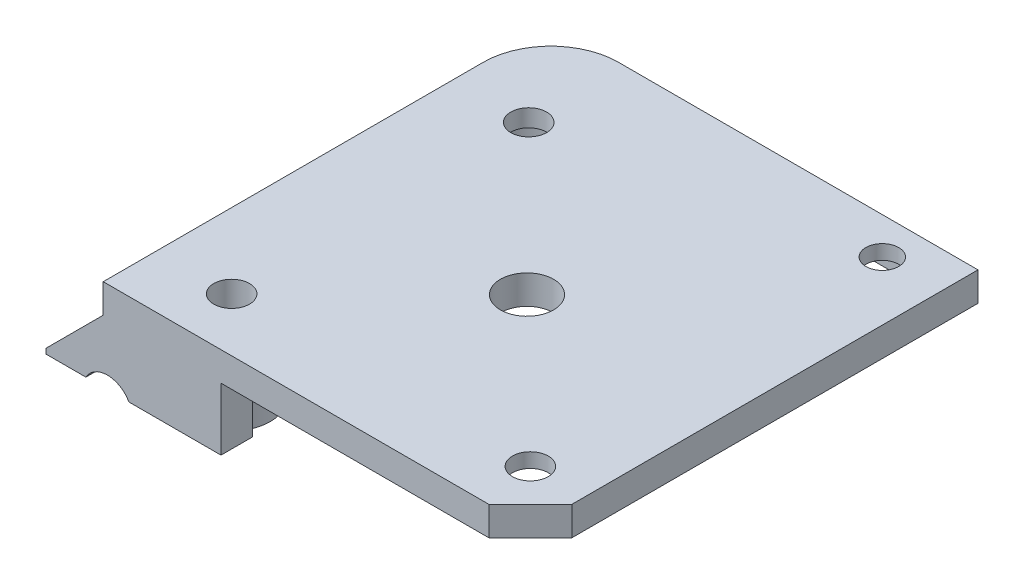
from build123d import *

# Parameters (mm, degrees)
SKETCH1_R                  = 13.5
BOSS_EXTRUDE1_DEPTH        = 3
CAVITY26_OUTLINE_R         = 1.85
CAVITY26_OUTLINE_R_2       = 1.7
CAVITY26_DEPTH             = 1.5
F_24_0_24_DIAMETER_HOLE1_D = 3.7
BOSS_EXTRUDE2_START        = -3
SKETCH6_R                  = 13.5
BOSS_EXTRUDE2_DEPTH        = 3
F_24_0_24_DIAMETER_HOLE2_D = 5.5
SKETCH14_W                 = 5.92
SKETCH14_H                 = 13
BOSS_EXTRUDE6_DEPTH        = 9.45
SKETCH13_R                 = 4
BOSS_EXTRUDE7_DEPTH        = 6.45
BOSS_EXTRUDE8_DEPTH        = 6.45
F_24_0_24_DIAMETER_HOLE3_D = 3.7
CUT_EXTRUDE3_DEPTH         = 9.06
SKETCH19_R                 = 2.55
CUT_EXTRUDE4_DEPTH         = 1.8
CUT_EXTRUDE5_START         = -11.2
SKETCH23_R                 = 4.233528458
CUT_EXTRUDE5_DEPTH         = 2.14
SKETCH24_W                 = 2.756109072
SKETCH24_H                 = 9.9
CUT_EXTRUDE6_DEPTH         = 10
CAVITY27_DEPTH             = 1.5
CAVITY27_START             = -6.45
CAVITY27_2_OUTLINE_R       = 3.15
CAVITY27_2_OUTLINE_R_2     = 1.85
CAVITY27_2_DEPTH           = 1.8
BOSS_EXTRUDE9_START        = 1.8
SKETCH25_R                 = 6.6
SKETCH25_R_2               = 1.85
BOSS_EXTRUDE9_DEPTH        = 1.8
SKETCH26_R                 = 4.5
CUT_EXTRUDE7_DEPTH         = 3
SKETCH27_R                 = 1.85
BOSS_EXTRUDE10_DEPTH       = 3
CUT_EXTRUDE8_START         = -1.5
CUT_EXTRUDE8_DEPTH         = 1.5
CUT_EXTRUDE9_DEPTH         = 15
F_24_0_24_DIAMETER_HOLE4_D = 3.4


# Read off the part's stored shape, not the designer's step: Cavity26, Cavity27
with BuildPart() as part:
    # Sketch1 → Boss-Extrude1 (new body)
    with BuildSketch(Plane(origin=(0, 0, 0), x_dir=(1, 0, 0), z_dir=(0, 1, 0))):
        with BuildLine():
            Line((39.88, -46.3), (44.18, -42))
            Line((44.18, -42), (44.18, 0))
            Line((44.18, 0), (7, 0))
            ThreePointArc((7, 0), (2.050252532, -2.050252532), (0, -7))
            Line((0, -7), (0, -46.3))
            Line((0, -46.3), (39.88, -46.3))
        make_face()
        with Locations(Location((23.07, -25.54, 0), (0, 0, 270))):
            Circle(SKETCH1_R, mode=Mode.SUBTRACT)
    extrude(amount=BOSS_EXTRUDE1_DEPTH)

    # Cavity26 outline → Cavity26 (cut)
    # profile 1 of 2: a face of its own
    with BuildSketch(Plane(origin=(0, 0, 0), x_dir=(1, 0, 0), z_dir=(0, 1, 0))):
        with BuildLine():
            Line((40.98, -20.5), (35.593913126, -20.5))
            ThreePointArc((35.593913126, -20.5), (36.300391291, -22.855461624), (36.567866498, -25.3))
            Line((36.567866498, -25.3), (40.93, -25.3))
            Line((40.93, -25.3), (40.93, -37.4))
            Line((40.93, -37.4), (37.464525778, -37.4))
            ThreePointArc((37.464525778, -37.4), (35.919832787, -38.039832787), (35.28, -39.584525778))
            Line((35.28, -39.584525778), (35.28, -43.05))
            Line((35.28, -43.05), (12.18, -43.05))
            Line((12.18, -43.05), (12.18, -44.675))
            Line((12.18, -44.675), (39.2422583, -44.675))
            Line((39.2422583, -44.675), (42.58, -41.3372583))
            Line((42.58, -41.3372583), (42.58, -22.55))
            Line((42.58, -22.55), (40.98, -22.55))
            Line((40.98, -22.55), (40.98, -20.5))
        make_face()
        with Locations((38.63, -40.75)):
            Circle(CAVITY26_OUTLINE_R, mode=Mode.SUBTRACT)
    # profile 2 of 2: a face of its own
    with BuildSketch(Plane(origin=(0, 0, 0), x_dir=(1, 0, 0), z_dir=(0, 1, 0))):
        with BuildLine():
            Line((40.98, -6.35), (42.58, -6.35))
            Line((42.58, -6.35), (42.58, -1.6))
            Line((42.58, -1.6), (28.18, -1.6))
            Line((28.18, -1.6), (28.18, -10.6))
            Line((28.18, -10.6), (29.56, -10.6))
            Line((29.56, -10.6), (29.56, -8.2))
            Line((29.56, -8.2), (31.16, -8.2))
            Line((31.16, -8.2), (31.16, -6.35))
            Line((31.16, -6.35), (35.06, -6.35))
            Line((35.06, -6.35), (35.06, -8.4))
            Line((35.06, -8.4), (36.21908731, -8.4))
            ThreePointArc((36.21908731, -8.4), (38.578420387, -7.150450959), (40.98, -8.31674455))
            Line((40.98, -8.31674455), (40.98, -6.35))
        make_face()
        with Locations((38.08, -3.8)):
            Circle(CAVITY26_OUTLINE_R_2, mode=Mode.SUBTRACT)
    extrude(amount=CAVITY26_DEPTH, mode=Mode.SUBTRACT)

    # Ø24.0 (24) Diameter Hole1 (through all)
    with Locations(Plane(origin=(0, 3, 0), x_dir=(1, 0, 0), z_dir=(0, 1, 0))):
        with Locations((38.63, -10.1), (38.63, -40.75), (7.73, -40.75), (7.73, -10.02)):
            Hole(F_24_0_24_DIAMETER_HOLE1_D / 2)

    # Sketch6 → Boss-Extrude2 (add)
    with BuildSketch(Plane(origin=(0, 3, 0), x_dir=(1, 0, 0), z_dir=(0, 1, 0)).offset(BOSS_EXTRUDE2_START)):
        with Locations((23.07, -25.54)):
            Circle(SKETCH6_R)
    extrude(amount=BOSS_EXTRUDE2_DEPTH)

    # Ø24.0 (24) Diameter Hole2 (through all)
    with Locations(Plane(origin=(0, 3, 0), x_dir=(1, 0, 0), z_dir=(0, 1, 0))):
        with Locations((23.07, -25.54)):
            Hole(F_24_0_24_DIAMETER_HOLE2_D / 2)

    # Sketch14 → Boss-Extrude6 (add)
    with BuildSketch(Plane(origin=(0, 3, 0), x_dir=(1, 0, 0), z_dir=(0, 1, 0))):
        with Locations((-2.96, -39.8)):
            Rectangle(SKETCH14_W, SKETCH14_H)
    extrude(amount=-BOSS_EXTRUDE6_DEPTH)

    # Sketch13 → Boss-Extrude7 (add)
    with BuildSketch(Plane(origin=(0, 0, 0), x_dir=(-1, 0, 0), z_dir=(0, -1, 0))):
        with Locations(Location((-7.73, -40.75, 0), (0, 0, 270))):
            Circle(SKETCH13_R)
    extrude(amount=BOSS_EXTRUDE7_DEPTH)

    # Sketch15 → Boss-Extrude8 (add)
    with BuildSketch(Plane(origin=(0, 0, 0), x_dir=(-1, 0, 0), z_dir=(0, -1, 0))):
        with BuildLine():
            Line((-11.002613634, -43.05), (-12.18, -43.05))
            Line((-12.18, -43.05), (-12.18, -44.675))
            Line((-12.18, -44.675), (-12.18, -46.3))
            Line((-12.18, -46.3), (0, -46.3))
            Line((0, -46.3), (0, -33.3))
            Line((0, -33.3), (-6.09, -33.3))
            Line((-6.09, -33.3), (-6.09, -37.101657911))
            ThreePointArc((-6.09, -37.101657911), (-4.371428875, -38.577443902), (-3.73, -40.75))
            ThreePointArc((-3.73, -40.75), (-6.523860401, -44.563820561), (-11.002613634, -43.05))
        make_face()
    extrude(amount=BOSS_EXTRUDE8_DEPTH)

    # Ø24.0 (24) Diameter Hole3 (through all)
    with Locations(Plane(origin=(0, 3, 0), x_dir=(1, 0, 0), z_dir=(0, 1, 0))):
        with Locations((7.73, -40.75)):
            Hole(F_24_0_24_DIAMETER_HOLE3_D / 2)

    # Sketch18 → Cut-Extrude3 (cut)
    with BuildSketch(Plane(origin=(0, 0, 33.3), x_dir=(-1, 0, 0), z_dir=(0, 0, -1))):
        Polygon((-0.43, -11.856921938), (3.17, -9.778460969), (3.17, -5.621539031), (-0.43, -3.543078062), (-4.03, -5.621539031), (-4.03, -9.778460969), align=None)
    extrude(amount=-CUT_EXTRUDE3_DEPTH, mode=Mode.SUBTRACT)

    # Sketch19 → Cut-Extrude4 (cut)
    with BuildSketch(Plane.XY.offset(46.3)):
        with Locations((0.43, -7.7)):
            Circle(SKETCH19_R)
    extrude(amount=-CUT_EXTRUDE4_DEPTH, mode=Mode.SUBTRACT)

    # Sketch23 → Cut-Extrude5 (cut)
    with BuildSketch(Plane(origin=(0, 0, 33.3), x_dir=(-1, 0, 0), z_dir=(0, 0, -1)).offset(CUT_EXTRUDE5_START)):
        with Locations((-0.43, -7.7)):
            Circle(SKETCH23_R)
    extrude(amount=CUT_EXTRUDE5_DEPTH, mode=Mode.SUBTRACT)

    # Sketch24 → Cut-Extrude6 (cut)
    with BuildSketch(Plane(origin=(0, 3, 0), x_dir=(1, 0, 0), z_dir=(0, 1, 0))):
        with Locations((-1.378054536, -39.55)):
            Rectangle(SKETCH24_W, SKETCH24_H)
    extrude(amount=-CUT_EXTRUDE6_DEPTH, mode=Mode.SUBTRACT)

    # Cavity27 outline → Cavity27 (cut)
    with BuildSketch(Plane(origin=(0, 0, 0), x_dir=(1, 0, 0), z_dir=(0, 1, 0))):
        with BuildLine():
            ThreePointArc((28.18, -21.3), (29.351572875, -24.128427125), (32.18, -25.3))
            Line((32.18, -25.3), (36.567866498, -25.3))
            ThreePointArc((36.567866498, -25.3), (36.300391291, -22.855461624), (35.593913126, -20.5))
            Line((35.593913126, -20.5), (35.06, -20.5))
            Line((35.06, -20.5), (35.06, -22.55))
            Line((35.06, -22.55), (31.16, -22.55))
            Line((31.16, -22.55), (31.16, -20.7))
            Line((31.16, -20.7), (29.56, -20.7))
            Line((29.56, -20.7), (29.56, -18.3))
            Line((29.56, -18.3), (28.18, -18.3))
            Line((28.18, -18.3), (28.18, -21.3))
        make_face()
    extrude(amount=CAVITY27_DEPTH, mode=Mode.SUBTRACT)

    # Cavity27 2 outline → Cavity27 2 (cut)
    with BuildSketch(Plane(origin=(0, 0, 0), x_dir=(1, 0, 0), z_dir=(0, 1, 0)).offset(CAVITY27_START)):
        with Locations((7.73, -40.75)):
            Circle(CAVITY27_2_OUTLINE_R)
        with Locations((7.73, -40.75)):
            Circle(CAVITY27_2_OUTLINE_R_2, mode=Mode.SUBTRACT)
    extrude(amount=CAVITY27_2_DEPTH, mode=Mode.SUBTRACT)

    # Sketch25 → Boss-Extrude9 (add)
    with BuildSketch(Plane.XZ.offset(BOSS_EXTRUDE9_START)):
        with Locations(Location((7.73, 10.02, 0), (0, 0, 90))):
            Circle(SKETCH25_R)
        with Locations(Location((7.73, 10.02, 0), (0, 0, 90))):
            Circle(SKETCH25_R_2, mode=Mode.SUBTRACT)
    extrude(amount=-BOSS_EXTRUDE9_DEPTH)

    # Sketch26 → Cut-Extrude7 (cut)
    with BuildSketch(Plane(origin=(0, -1.8, 0), x_dir=(-1, 0, 0), z_dir=(0, -1, 0))):
        with Locations(Location((-7.73, -10.02, 0), (0, 0, 90))):
            Circle(SKETCH26_R)
    extrude(amount=-CUT_EXTRUDE7_DEPTH, mode=Mode.SUBTRACT)

    # Sketch27 → Boss-Extrude10 (add)
    with BuildSketch(Plane(origin=(0, 0, 0), x_dir=(-1, 0, 0), z_dir=(0, -1, 0))):
        with Locations((-38.63, -10.1)):
            Circle(SKETCH27_R)
    extrude(amount=-BOSS_EXTRUDE10_DEPTH)

    # Sketch28 → Cut-Extrude8 (cut)
    with BuildSketch(Plane(origin=(0, 0, 0), x_dir=(-1, 0, 0), z_dir=(0, -1, 0)).offset(CUT_EXTRUDE8_START)):
        Polygon((-42.58, -22.55), (-42.58, -1.6), (-28.18, -1.6), (-28.18, -18.3), (-28.18, -43.05), (-35.28, -43.05), (-40.91112915, -43.00612915), (-42.217305027, -41.699953273), align=None)
    extrude(amount=CUT_EXTRUDE8_DEPTH, mode=Mode.SUBTRACT)

    # Sketch29 → Cut-Extrude9 (cut)
    with BuildSketch(Plane.XY.offset(46.3)):
        Polygon((0, 0), (-5.92, -5.92), (-5.92, 3), (0, 3), align=None)
    extrude(amount=-CUT_EXTRUDE9_DEPTH, mode=Mode.SUBTRACT)

    # Ø24.0 (24) Diameter Hole4 (through all)
    with Locations(Plane(origin=(0, 3, 0), x_dir=(1, 0, 0), z_dir=(0, 1, 0))):
        with Locations((38.08, -3.8)):
            Hole(F_24_0_24_DIAMETER_HOLE4_D / 2)


solid = part.part
